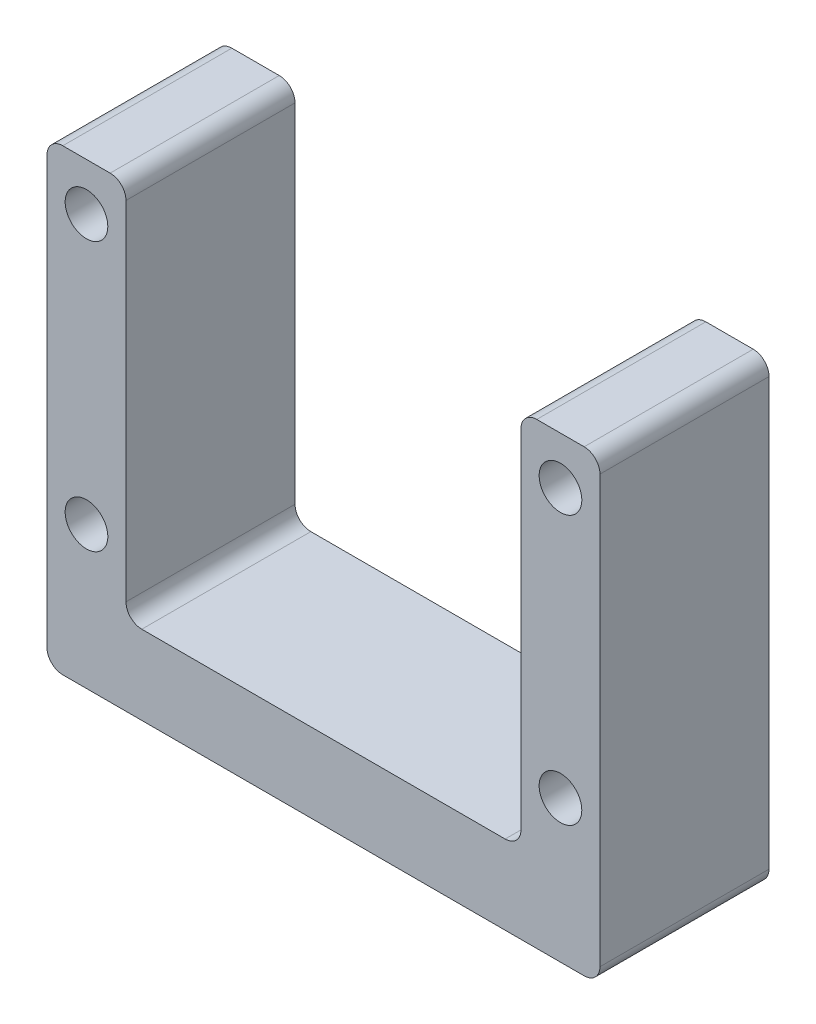
from build123d import *

# Parameters (mm, degrees)
BOSS_EXTRU_1_DEPTH           = 10.7
ENL_V_MAT_EXTRU_1_DEPTH      = 32.571189398
ENL_V_MAT_EXTRU_1_DEPTH_BACK = 32.571189398
ESQUISSE2_R                  = 1.35
CONG_1_R                     = 1


with BuildPart() as part:
    # Esquisse1 → Boss.-Extru.1 (new body)
    with BuildSketch(Plane.XY):
        Polygon((-12.5, 0), (12.5, 0), (12.5, 24), (17.5, 24), (17.5, -5), (-17.5, -5), (-17.5, 24), (-12.5, 24), align=None)
    extrude(amount=BOSS_EXTRU_1_DEPTH)

    # Esquisse2 → Enlèv. mat.-Extru.1 (cut, two sides: drawn at the far end of the back side and taken through both)
    with BuildSketch(Plane.XY.offset(10.7).offset(-ENL_V_MAT_EXTRU_1_DEPTH_BACK)):
        with Locations((-15, 21)):
            Circle(ESQUISSE2_R)
        with Locations((-15, 4)):
            Circle(ESQUISSE2_R)
        with Locations((15, 4)):
            Circle(ESQUISSE2_R)
        with Locations((15, 21)):
            Circle(ESQUISSE2_R)
    extrude(amount=ENL_V_MAT_EXTRU_1_DEPTH + ENL_V_MAT_EXTRU_1_DEPTH_BACK, mode=Mode.SUBTRACT)

    # Congé1
    cong_1_edges = [part.edges().sort_by_distance(p)[0] for p in [
        (12.5, 24, 5.35),
        (-12.5, 24, 5.35),
        (17.5, -5, 5.35),
        (-17.5, -5, 5.35),
        (-17.5, 24, 5.35),
        (17.5, 24, 5.35),
        (12.5, 0, 5.35),
        (-12.5, 0, 5.35),
    ]]
    fillet(cong_1_edges, radius=CONG_1_R)


solid = part.part
